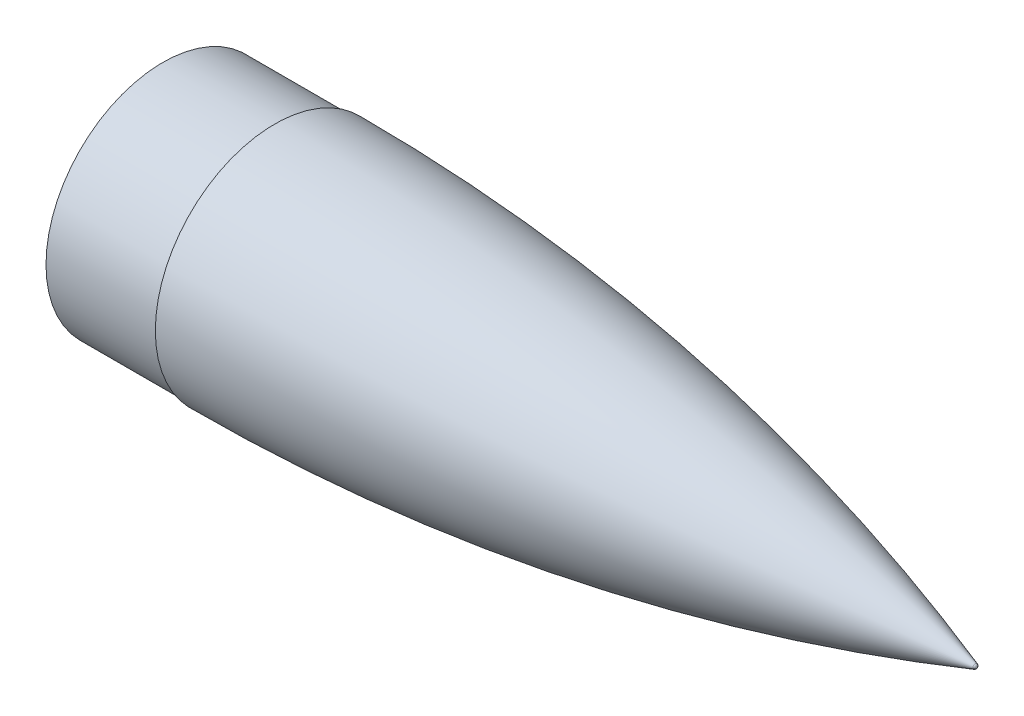
from build123d import *


with BuildPart() as part:
    # 草圖2 → 旋轉1 (revolve)
    with BuildSketch(Plane.XY):
        with BuildLine():
            ThreePointArc((-1.350029202, 1.891438067), (-276.213874081, 71.562740986), (-558.8, 95))
            Line((-558.8, 95), (-558.8, 94))
            ThreePointArc((-558.8, 94), (-559.092893219, 93.292893219), (-559.8, 93))
            Line((-559.8, 93), (-647.8, 93))
            Line((-647.8, 93), (-647.8, 91))
            Line((-647.8, 91), (-558.8, 91))
            Line((-558.8, 91), (-558.8, 91.499707911))
            ThreePointArc((-558.8, 91.499707911), (-558.506900213, 92.2070212), (-557.799415822, 92.49970774))
            ThreePointArc((-557.799415822, 92.49970774), (-276.850737177, 69.134466022), (-3.54043704, 0))
            Line((-3.54043704, 0), (0, 0))
            ThreePointArc((0, 0), (-0.37212691, 1.16190757), (-1.350029202, 1.891438067))
        make_face()
    revolve(axis=Axis((-711, 0, 0), (1, 0, 0)))


solid = part.part
